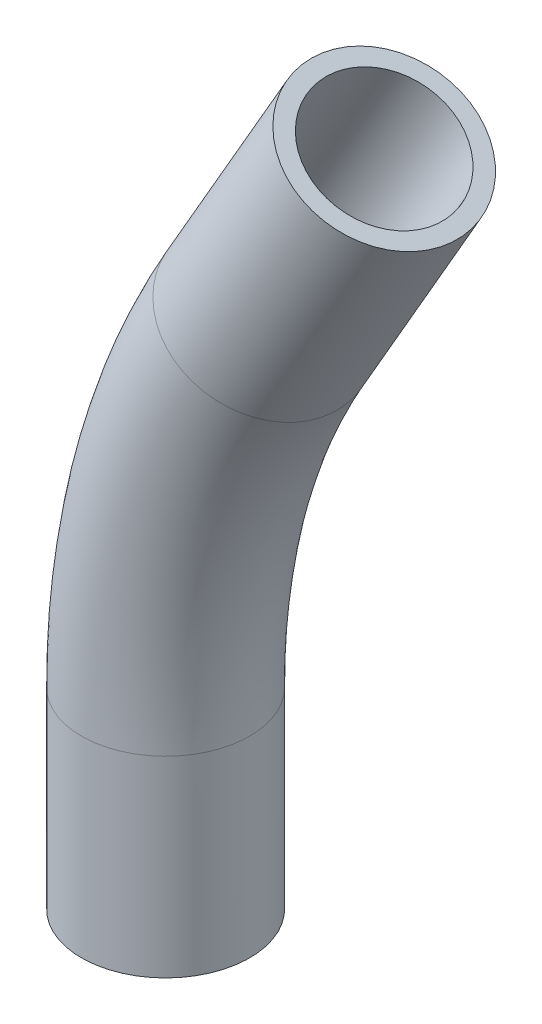
from build123d import *

# Parameters (mm, degrees)
ROUTE_R                       = 16.7005
ELBOWSHELL_T                  = -3.3782
SKETCH2_R                     = 16.7005
SKETCH2_R_2                   = 13.3223
ELBOWEXTENSION_EXTRUDE1_DEPTH = 47.625
SKETCH3_R                     = 16.7005
SKETCH3_R_2                   = 13.3223
ELBOWEXTENSION_EXTRUDE2_DEPTH = 38.1


with BuildPart() as part:
    # Elbow: sweep along a path in ElbowArc
    with BuildLine(Plane.XY) as elbow_path:
        ThreePointArc((-146.05, 0), (-141.07346693, 37.800521537), (-126.483010223, 73.025))
    # Route → Elbow (sweep)
    with BuildSketch(Plane(origin=(0, 0, 0), x_dir=(1, 0, 0), z_dir=(0, 1, 0))):
        with Locations((-146.05, 0)):
            Circle(ROUTE_R)
    sweep(path=elbow_path.line)

    # ElbowShell
    elbowshell_openings = [part.faces().sort_by_distance(p)[0] for p in [
        (-126.483010223, 73.025, 0),
        (-146.05, 0, 0),
    ]]
    offset(amount=ELBOWSHELL_T, openings=elbowshell_openings, kind=Kind.INTERSECTION)

    # Sketch2 → ElbowExtension-Extrude1 (add)
    with BuildSketch(Plane(origin=(0, 0, 0), x_dir=(-0.8660254037844382, 0.500000000000001, 0), z_dir=(0.5000000000000009, 0.866025403784438, 0))):
        with Locations((146.05, 0)):
            Circle(SKETCH2_R)
        with Locations((146.05, 0)):
            Circle(SKETCH2_R_2, mode=Mode.SUBTRACT)
    extrude(amount=ELBOWEXTENSION_EXTRUDE1_DEPTH)

    # Sketch3 → ElbowExtension-Extrude2 (add)
    with BuildSketch(Plane.XZ):
        with Locations((-146.05, 0)):
            Circle(SKETCH3_R)
        with Locations((-146.05, 0)):
            Circle(SKETCH3_R_2, mode=Mode.SUBTRACT)
    extrude(amount=ELBOWEXTENSION_EXTRUDE2_DEPTH)


solid = part.part
